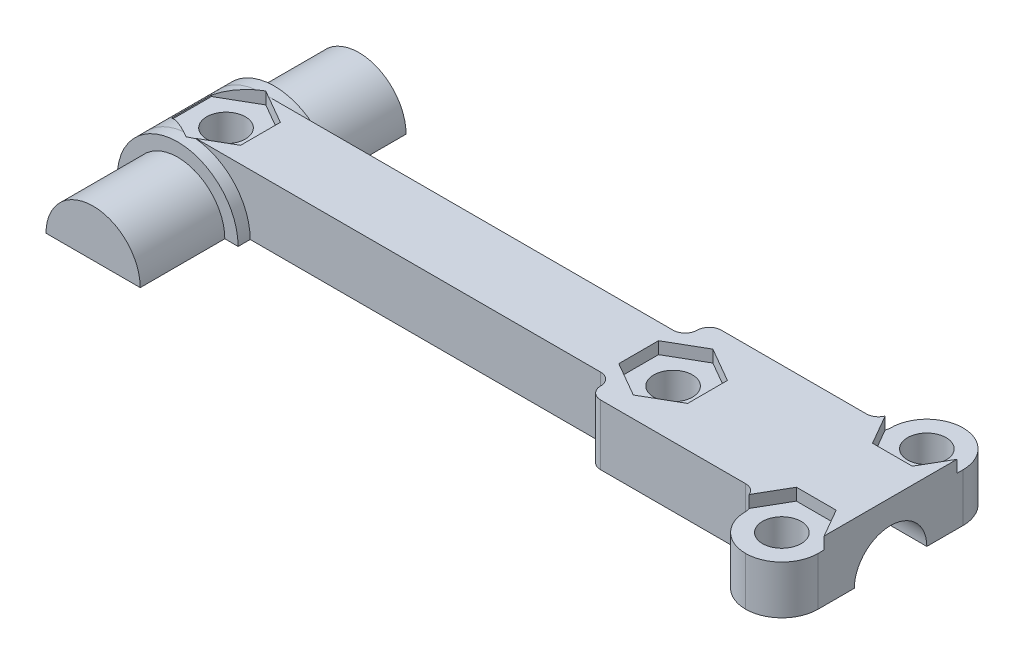
from build123d import *

# Parameters (mm, degrees)
SKETCH1_W           = 10
SKETCH1_H           = 6
BOSS_EXTRUDE1_DEPTH = 5
BOSS_EXTRUDE3_DEPTH = 1
BOSS_EXTRUDE4_DEPTH = 7
SKETCH4_W           = 6
SKETCH4_H           = 5
BOSS_EXTRUDE5_DEPTH = 30
SKETCH5_W           = 14
SKETCH5_H           = 10
BOSS_EXTRUDE6_DEPTH = 5
FILLET17_R          = 5
SKETCH8_W           = 18
SKETCH8_H           = 5
BOSS_EXTRUDE7_DEPTH = 6
FILLET8_R           = 1
CUT_EXTRUDE3_DEPTH  = 15
SKETCH10_R          = 1.6
CUT_EXTRUDE4_DEPTH  = 57.311632901
FILLET11_R          = 3
CUT_EXTRUDE9_DEPTH  = 1
SKETCH14_W          = 6
SKETCH14_H          = 5
CUT_EXTRUDE10_DEPTH = 1


with BuildPart() as part:
    # Sketch1 → Boss-Extrude1 (new body)
    with BuildSketch(Plane(origin=(0, 0, 0), x_dir=(1, 0, 0), z_dir=(0, 1, 0))):
        Rectangle(SKETCH1_W, SKETCH1_H)
    extrude(amount=BOSS_EXTRUDE1_DEPTH)

    # Sketch2 → Boss-Extrude3 (add)
    with BuildSketch(Plane.XY.offset(3)):
        with BuildLine():
            Line((-5, 0), (5, 0))
            ThreePointArc((5, 0), (0, 5), (-5, 0))
        make_face()
    boss_extrude3 = extrude(amount=BOSS_EXTRUDE3_DEPTH)

    # Sketch3 → Boss-Extrude4 (add)
    with BuildSketch(Plane.XY.offset(4)):
        with BuildLine():
            Line((-3.9, 0), (3.9, 0))
            ThreePointArc((3.9, 0), (0, 3.9), (-3.9, 0))
        make_face()
    boss_extrude4 = extrude(amount=BOSS_EXTRUDE4_DEPTH)

    # Mirror1: Boss-Extrude3, Boss-Extrude4 across plane
    add(boss_extrude3.mirror(Plane.XY))
    add(boss_extrude4.mirror(Plane.XY))

    # Sketch4 → Boss-Extrude5 (add)
    with BuildSketch(Plane(origin=(5, 0, 0), x_dir=(0, 0, -1), z_dir=(1, 0, 0))):
        with Locations((0, 2.5)):
            Rectangle(SKETCH4_W, SKETCH4_H)
    extrude(amount=BOSS_EXTRUDE5_DEPTH)

    # Sketch5 → Boss-Extrude6 (add)
    with BuildSketch(Plane(origin=(0, 0, 0), x_dir=(1, 0, 0), z_dir=(0, 1, 0))):
        with Locations((42, 0)):
            Rectangle(SKETCH5_W, SKETCH5_H)
    extrude(amount=BOSS_EXTRUDE6_DEPTH)

    # Fillet17
    fillet17_edges = [part.edges().sort_by_distance(p)[0] for p in [
        (-5, 5, 0),
    ]]
    fillet(fillet17_edges, radius=FILLET17_R - 0.0001)  # a hair under: the kernel refuses the full size

    # Sketch8 → Boss-Extrude7 (add)
    with BuildSketch(Plane(origin=(49, 0, 0), x_dir=(0, 0, -1), z_dir=(1, 0, 0))):
        with Locations((0, 2.5)):
            Rectangle(SKETCH8_W, SKETCH8_H)
    extrude(amount=BOSS_EXTRUDE7_DEPTH)

    # Fillet8
    fillet8_edges = [part.edges().sort_by_distance(p)[0] for p in [
        (49, 2.5, 5),
        (35, 2.5, 5),
        (35, 2.5, 3),
        (35, 2.5, -3),
        (35, 2.5, -5),
        (49, 2.5, -5),
    ]]
    fillet(fillet8_edges, radius=FILLET8_R - 0.0001)  # a hair under: the kernel refuses the full size

    # Sketch9 → Cut-Extrude3 (cut)
    with BuildSketch(Plane(origin=(55, 0, 0), x_dir=(0, 0, -1), z_dir=(1, 0, 0))):
        with BuildLine():
            Line((-3, 0), (3, 0))
            ThreePointArc((3, 0), (0, 3), (-3, 0))
        make_face()
    extrude(amount=-CUT_EXTRUDE3_DEPTH, mode=Mode.SUBTRACT)

    # Sketch10 → Cut-Extrude4 (cut, through all)
    with BuildSketch(Plane.XZ):
        with Locations(Location((52, 6, 0), (0, 0, 270))):
            Circle(SKETCH10_R)
        with Locations(Location((52, -6, 0), (0, 0, 270))):
            Circle(SKETCH10_R)
        with Locations(Location((37, 0, 0), (0, 0, 270))):
            Circle(SKETCH10_R)
        with Locations(Location((0, 0, 0), (0, 0, 270))):
            Circle(SKETCH10_R)
    extrude(amount=-CUT_EXTRUDE4_DEPTH, mode=Mode.SUBTRACT)

    # Fillet11
    fillet11_edges = [part.edges().sort_by_distance(p)[0] for p in [
        (49, 2.5, -9),
        (55, 2.5, -9),
        (49, 2.5, 9),
        (55, 2.5, 9),
    ]]
    fillet(fillet11_edges, radius=FILLET11_R - 0.0001)  # a hair under: the kernel refuses the full size

    # Sketch13 → Cut-Extrude9 (cut)
    with BuildSketch(Plane(origin=(0, 5, 0), x_dir=(1, 0, 0), z_dir=(0, 1, 0))):
        Polygon((55.290896534, -6), (53.645448267, -3.15), (50.354551733, -3.15), (48.709103466, -6), (50.354551733, -8.85), (53.645448267, -8.85), align=None)
        Polygon((55.290896534, 6), (53.645448267, 8.85), (50.354551733, 8.85), (48.709103466, 6), (50.354551733, 3.15), (53.645448267, 3.15), align=None)
        Polygon((39.85, -1.645448267), (39.85, 1.645448267), (37, 3.290896534), (34.15, 1.645448267), (34.15, -1.645448267), (37, -3.290896534), align=None)
        Polygon((0, -3.290896534), (2.85, -1.645448267), (2.85, 1.645448267), (0, 3.290896534), (-2.85, 1.645448267), (-2.85, -1.645448267), align=None)
    extrude(amount=-CUT_EXTRUDE9_DEPTH, mode=Mode.SUBTRACT)

    # Sketch14 → Cut-Extrude10 (cut)
    with BuildSketch(Plane(origin=(0, 5, 0), x_dir=(1, 0, 0), z_dir=(0, 1, 0))):
        with Locations((52, -7.996152423)):
            Rectangle(SKETCH14_W, SKETCH14_H)
        with Locations((52, 7.996152423)):
            Rectangle(SKETCH14_W, SKETCH14_H)
    extrude(amount=-CUT_EXTRUDE10_DEPTH, mode=Mode.SUBTRACT)


solid = part.part
